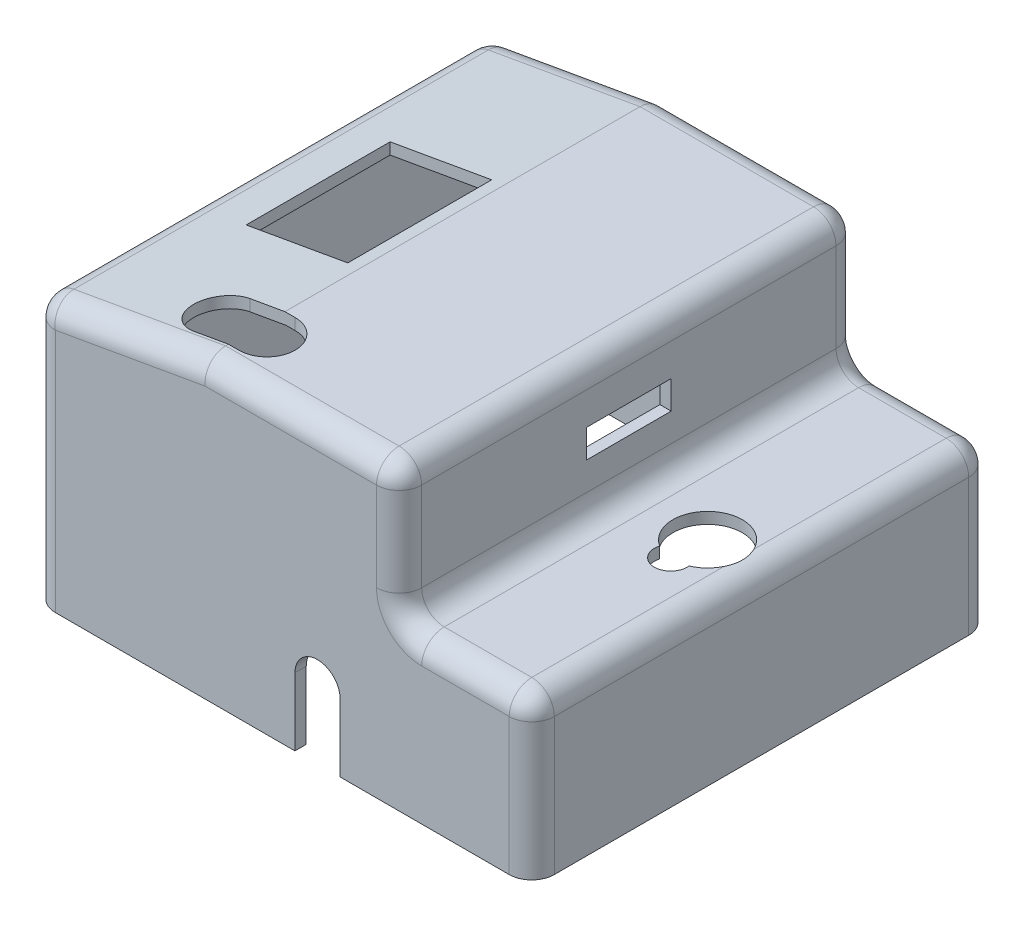
from build123d import *

# Parameters (mm, degrees)
BOSS_EXTRUDE1_DEPTH      = 38.7
BOSS_EXTRUDE1_DEPTH_BACK = 38.7
CHAMFER1_SIZE            = 5
CHAMFER1_SIZE2           = 28.356409098
SHELL1_T                 = 2
FILLET2_R                = 4
BOSS_EXTRUDE2_START      = -1.5
SKETCH2_W                = 6
SKETCH2_H                = 2.5
SKETCH2_H_2              = 6
SKETCH2_R                = 1.45
BOSS_EXTRUDE2_DEPTH      = 4
FILLET3_R                = 2
CUT_EXTRUDE1_REACH       = 68.394
SKETCH3_R                = 6.15
SKETCH3_R_2              = 2.9
BOSS_EXTRUDE3_START      = -1.5
SKETCH4_W                = 5
SKETCH4_H                = 20
BOSS_EXTRUDE3_DEPTH      = 2
FILLET4_R                = 2
CUT_EXTRUDE2_REACH       = 94.588
SKETCH5_W                = 15
SKETCH5_H                = 5
CUT_EXTRUDE3_DEPTH       = 107.224291049
CUT_EXTRUDE4_REACH       = 92.819
SKETCH7_W                = 18
SKETCH7_H                = 25.5
CUT_EXTRUDE5_REACH       = 81.462
CUT_EXTRUDE6_REACH       = 108.224
SKETCH10_W               = 13
SKETCH10_H               = 8
FILLET5_R                = 2


with BuildPart() as part:
    # Sketch1 → Boss-Extrude1 (new, two sides: drawn at the far end of the back side and taken through both)
    with BuildSketch(Plane.XY.offset(-BOSS_EXTRUDE1_DEPTH_BACK)):
        Polygon((-42.2, 0), (42.2, 0), (42.2, 26.25), (18.7, 26.25), (18.7, 50), (-42.2, 50), align=None)
    extrude(amount=BOSS_EXTRUDE1_DEPTH + BOSS_EXTRUDE1_DEPTH_BACK)

    # Chamfer1
    chamfer1_edges = [part.edges().sort_by_distance(p)[0] for p in [
        (-42.2, 50, 0),
    ]]
    chamfer1_side = [part.faces().sort_by_distance(p)[0] for p in [
        (-42.2, 25, 0),
    ]]
    chamfer(chamfer1_edges, length=CHAMFER1_SIZE, length2=CHAMFER1_SIZE2, reference=chamfer1_side[0])

    # Shell1
    shell1_openings = [part.faces().sort_by_distance(p)[0] for p in [
        (0, 0, 0),
    ]]
    offset(amount=SHELL1_T, openings=shell1_openings, kind=Kind.INTERSECTION)

    # Fillet2
    # the kernel refuses this fillet: 4 mm, written as the material it adds along each edge
    with BuildSketch(Plane(origin=(20.7, 28.25, -40.7), x_dir=(0, 1, 0), z_dir=(0, 0, 1))) as fillet2_piece_1:
        with BuildLine():
            CenterArc((FILLET2_R, -FILLET2_R), FILLET2_R, 90, 90)
            Line((0, -FILLET2_R), (0, 0))
            Line((0, 0), (FILLET2_R, 0))
        make_face()
    extrude(amount=81.4)
    # the kernel refuses this fillet: 4 mm, written as the material it takes off along each edge
    with BuildSketch(Plane(origin=(-40.2, 43.321800738, 36.7), x_dir=(-0.1736481776669273, 0.9848077530122087, 0), z_dir=(0, 0, 1))) as fillet2_2_piece_1_section:
        Polygon((0, 0), (FILLET2_R, 0), (FILLET2_R, FILLET2_R * 0.839099631177), (FILLET2_R * 0.173648177667, FILLET2_R * 0.984807753012), align=None)
    fillet2_2_piece_1 = extrude(amount=FILLET2_R, mode=Mode.PRIVATE)
    fillet2_2_piece_1 = fillet2_2_piece_1 - Plane(origin=(-40.2, 43.321800738, 36.7), x_dir=(0.766044443118977, -0.6427876096865405, 0), z_dir=(0, 0, 1)) * Sphere(FILLET2_R, mode=Mode.PRIVATE)
    add(fillet2_2_piece_1, mode=Mode.SUBTRACT)
    with BuildSketch(Plane(origin=(-40.2, 43.321800738, -36.7), x_dir=(-0.1736481776669273, 0.9848077530122087, 0), z_dir=(0, 0, -1))) as fillet2_2_piece_2_section:
        Polygon((0, 0), (FILLET2_R, 0), (FILLET2_R, -FILLET2_R * 0.839099631177), (FILLET2_R * 0.173648177667, -FILLET2_R * 0.984807753012), align=None)
    fillet2_2_piece_2 = extrude(amount=FILLET2_R, mode=Mode.PRIVATE)
    fillet2_2_piece_2 = fillet2_2_piece_2 - Plane(origin=(-40.2, 43.321800738, -36.7), x_dir=(0.766044443118977, -0.6427876096865405, 0), z_dir=(0, 0, -1)) * Sphere(FILLET2_R, mode=Mode.PRIVATE)
    add(fillet2_2_piece_2, mode=Mode.SUBTRACT)
    with BuildSketch(Plane(origin=(20.7, 52, 50.7), x_dir=(0, -1, 0), z_dir=(0, 0, -1)), Plane(origin=(44.2, 28.25, 50.7), x_dir=(0, -1, 0), z_dir=(0, 0, -1))) as fillet2_2_piece_3:
        with BuildLine():
            CenterArc((FILLET2_R, FILLET2_R), FILLET2_R, 180, 90)
            Line((0, FILLET2_R), (0, 0))
            Line((0, 0), (FILLET2_R, 0))
        make_face()
    extrude(amount=101.4, mode=Mode.SUBTRACT)
    with BuildSketch(Plane(origin=(44.2, 38.25, -40.7), x_dir=(0, 0, 1), z_dir=(0, -1, 0))) as fillet2_2_piece_4:
        with BuildLine():
            CenterArc((FILLET2_R, FILLET2_R), FILLET2_R, 180, 90)
            Line((0, FILLET2_R), (0, 0))
            Line((0, 0), (FILLET2_R, 0))
        make_face()
    extrude(amount=48.25, mode=Mode.SUBTRACT)
    with BuildSketch(Plane(origin=(44.2, -10, 40.7), x_dir=(-1, 0, 0), z_dir=(0, 1, 0))) as fillet2_2_piece_5:
        with BuildLine():
            CenterArc((FILLET2_R, -FILLET2_R), FILLET2_R, 90, 90)
            Line((0, -FILLET2_R), (0, 0))
            Line((0, 0), (FILLET2_R, 0))
        make_face()
    extrude(amount=48.25, mode=Mode.SUBTRACT)
    with BuildSketch(Plane(origin=(30.7, 52, 40.7), x_dir=(0, -1, 0), z_dir=(-1, 0, 0)), Plane(origin=(-24.018568229, 52, -40.7), x_dir=(0, -1, 0), z_dir=(1, 0, 0))) as fillet2_2_piece_6:
        with BuildLine():
            CenterArc((FILLET2_R, -FILLET2_R), FILLET2_R, 90, 90)
            Line((0, -FILLET2_R), (0, 0))
            Line((0, 0), (FILLET2_R, 0))
        make_face()
    extrude(amount=54.718568229, mode=Mode.SUBTRACT)
    with BuildSketch(Plane(origin=(-44.2, 43.321800738, 40.7), x_dir=(0, 0, -1), z_dir=(0, -1, 0)), Plane(origin=(-44.2, -10, -40.7), x_dir=(0, 0, 1), z_dir=(0, 1, 0))) as fillet2_2_piece_7:
        with BuildLine():
            CenterArc((FILLET2_R, FILLET2_R), FILLET2_R, 180, 90)
            Line((0, FILLET2_R), (0, 0))
            Line((0, 0), (FILLET2_R, 0))
        make_face()
    extrude(amount=53.321800738, mode=Mode.SUBTRACT)
    with BuildSketch(Plane(origin=(-4.170490699, 53.736481777, 40.7), x_dir=(0.17364817766692728, -0.9848077530122086, 0), z_dir=(-0.9848077530122087, -0.1736481776669273, 0)), Plane(origin=(-40.894592711, 47.26103175, -40.7), x_dir=(0.1736481776669273, -0.9848077530122087, 1.77635683940025e-15), z_dir=(0.9848077530122087, 0.1736481776669273, 0))) as fillet2_2_piece_8:
        with BuildLine():
            CenterArc((FILLET2_R, -FILLET2_R), FILLET2_R, 90, 90)
            Line((0, -FILLET2_R), (0, 0))
            Line((0, 0), (FILLET2_R, 0))
        make_face()
    extrude(amount=37.29063048, mode=Mode.SUBTRACT)
    with BuildSketch(Plane(origin=(-44.2, 46.678199262, -36.7), x_dir=(0, -1, 0), z_dir=(0, 0, 1))) as fillet2_2_piece_9:
        with BuildLine():
            CenterArc((FILLET2_R * 0.839099631177, FILLET2_R), FILLET2_R, 190, 80)
            Line((-FILLET2_R * 0.145708121835, FILLET2_R * 0.826351822333), (0, 0))
            Line((0, 0), (FILLET2_R * 0.839099631177, 0))
        make_face()
    extrude(amount=73.4, mode=Mode.SUBTRACT)
    # the kernel refuses this fillet: 4 mm, written as the material it takes off along each edge
    with BuildSketch(Plane(origin=(16.7, 48, -36.7), x_dir=(1, 0, 0), z_dir=(0, 0, -1))) as fillet2_3_piece_1_section:
        Polygon((0, 0), (FILLET2_R, 0), (FILLET2_R, -FILLET2_R), (0, -FILLET2_R), align=None)
    fillet2_3_piece_1 = extrude(amount=FILLET2_R, mode=Mode.PRIVATE)
    fillet2_3_piece_1 = fillet2_3_piece_1 - Plane(origin=(16.7, 48, -36.7), x_dir=(-0.7071067811865475, -0.7071067811865476, 0), z_dir=(0, 0, -1)) * Sphere(FILLET2_R, mode=Mode.PRIVATE)
    add(fillet2_3_piece_1, mode=Mode.SUBTRACT)
    with BuildSketch(Plane(origin=(16.7, 48, 36.7), x_dir=(1, 0, 0), z_dir=(0, 0, 1))) as fillet2_3_piece_2_section:
        Polygon((0, 0), (FILLET2_R, 0), (FILLET2_R, FILLET2_R), (0, FILLET2_R), align=None)
    fillet2_3_piece_2 = extrude(amount=FILLET2_R, mode=Mode.PRIVATE)
    fillet2_3_piece_2 = fillet2_3_piece_2 - Plane(origin=(16.7, 48, 36.7), x_dir=(-0.7071067811865475, -0.7071067811865476, 0), z_dir=(0, 0, 1)) * Sphere(FILLET2_R, mode=Mode.PRIVATE)
    add(fillet2_3_piece_2, mode=Mode.SUBTRACT)
    with BuildSketch(Plane(origin=(40.2, 24.25, 36.7), x_dir=(0, 1, 0), z_dir=(0, 0, 1))) as fillet2_3_piece_3_section:
        Polygon((0, 0), (FILLET2_R, 0), (FILLET2_R, -FILLET2_R), (0, -FILLET2_R), align=None)
    fillet2_3_piece_3 = extrude(amount=FILLET2_R, mode=Mode.PRIVATE)
    fillet2_3_piece_3 = fillet2_3_piece_3 - Plane(origin=(40.2, 24.25, 36.7), x_dir=(-0.7071067811865475, -0.7071067811865476, 0), z_dir=(0, 0, 1)) * Sphere(FILLET2_R, mode=Mode.PRIVATE)
    add(fillet2_3_piece_3, mode=Mode.SUBTRACT)
    with BuildSketch(Plane(origin=(40.2, 24.25, -36.7), x_dir=(0, 1, 0), z_dir=(0, 0, -1))) as fillet2_3_piece_4_section:
        Polygon((0, 0), (FILLET2_R, 0), (FILLET2_R, FILLET2_R), (0, FILLET2_R), align=None)
    fillet2_3_piece_4 = extrude(amount=FILLET2_R, mode=Mode.PRIVATE)
    fillet2_3_piece_4 = fillet2_3_piece_4 - Plane(origin=(40.2, 24.25, -36.7), x_dir=(-0.7071067811865475, -0.7071067811865476, 0), z_dir=(0, 0, -1)) * Sphere(FILLET2_R, mode=Mode.PRIVATE)
    add(fillet2_3_piece_4, mode=Mode.SUBTRACT)
    with BuildSketch(Plane(origin=(24.7, 28.25, -40.7), x_dir=(0, -1, 0), z_dir=(1, 0, 0)), Plane(origin=(40.2, 28.25, 40.7), x_dir=(0, -1, 0), z_dir=(-1, 0, 0))) as fillet2_3_piece_5:
        with BuildLine():
            CenterArc((FILLET2_R, -FILLET2_R), FILLET2_R, 90, 90)
            Line((0, -FILLET2_R), (0, 0))
            Line((0, 0), (FILLET2_R, 0))
        make_face()
    extrude(amount=15.5, mode=Mode.SUBTRACT)
    with BuildSketch(Plane(origin=(20.7, 32.25, 40.7), x_dir=(-1, 0, 0), z_dir=(0, 1, 0)), Plane(origin=(20.7, 48, -40.7), x_dir=(-1, 0, 0), z_dir=(0, -1, 0))) as fillet2_3_piece_6:
        with BuildLine():
            CenterArc((FILLET2_R, -FILLET2_R), FILLET2_R, 90, 90)
            Line((0, -FILLET2_R), (0, 0))
            Line((0, 0), (FILLET2_R, 0))
        make_face()
    extrude(amount=15.75, mode=Mode.SUBTRACT)
    with BuildSketch(Plane(origin=(24.7, 32.25, -40.7), x_dir=(-1, 0, 0), z_dir=(0, 1, 0))) as fillet2_3_piece_7:
        with BuildLine():
            CenterArc((4 + FILLET2_R, FILLET2_R), FILLET2_R, 180, 90)
            Line((4, FILLET2_R), (4, 0))
            Line((4, 0), (4 + FILLET2_R, 0))
        make_face()
    revolve(axis=Axis((24.7, 32.25, -40.7), (0, 0, 1)), revolution_arc=90, mode=Mode.SUBTRACT)
    with BuildSketch(Plane(origin=(24.7, 32.25, 40.7), x_dir=(-1, 0, 0), z_dir=(0, 1, 0))) as fillet2_3_piece_8:
        with BuildLine():
            CenterArc((4 + FILLET2_R, -FILLET2_R), FILLET2_R, 90, 90)
            Line((4, -FILLET2_R), (4, 0))
            Line((4, 0), (4 + FILLET2_R, 0))
        make_face()
    revolve(axis=Axis((24.7, 32.25, 40.7), (0, 0, 1)), revolution_arc=90, mode=Mode.SUBTRACT)

    # Sketch2 → Boss-Extrude2 (add)
    # profile 1 of 2: a face of its own
    with BuildSketch(Plane.XZ.offset(BOSS_EXTRUDE2_START)):
        with Locations((39.2, -37.45)):
            Rectangle(SKETCH2_W, SKETCH2_H)
    # profile 2 of 2: a face of its own
    with BuildSketch(Plane.XZ.offset(BOSS_EXTRUDE2_START)):
        with Locations((39.2, -33.2)):
            Rectangle(SKETCH2_W, SKETCH2_H_2)
        with Locations(Location((39.2, -33.2, 0), (0, 0, 270))):
            Circle(SKETCH2_R, mode=Mode.SUBTRACT)
    boss_extrude2 = extrude(amount=-BOSS_EXTRUDE2_DEPTH)

    # Mirror1: Boss-Extrude2 across plane
    add(boss_extrude2.mirror(Plane.XY))

    # Fillet3
    fillet3_edges = [part.edges().sort_by_distance(p)[0] for p in [
        (42.2, 3.5, -30.2),
        (36.2, 3.5, -38.7),
        (36.2, 3.5, -30.2),
        (42.2, 3.5, 30.2),
        (36.2, 3.5, 30.2),
        (36.2, 3.5, 38.7),
    ]]
    fillet(fillet3_edges, radius=FILLET3_R)

    # Sketch3 → Cut-Extrude1 (cut, up to next)
    with BuildSketch(Plane(origin=(0, 28.25, 0), x_dir=(1, 0, 0), z_dir=(0, 1, 0)), mode=Mode.PRIVATE) as cut_extrude1_sk1:
        with Locations((34.65, 0)):
            Circle(SKETCH3_R)
    cut_extrude1_tool1 = extrude(cut_extrude1_sk1.sketch, amount=-CUT_EXTRUDE1_REACH, mode=Mode.PRIVATE) & part.part
    # Sketch3 → Cut-Extrude1 (cut, up to next)
    with BuildSketch(Plane(origin=(0, 28.25, 0), x_dir=(1, 0, 0), z_dir=(0, 1, 0)), mode=Mode.PRIVATE) as cut_extrude1_sk2:
        with Locations((34.151698836, -6.029444083)):
            Circle(SKETCH3_R_2)
    cut_extrude1_tool2 = extrude(cut_extrude1_sk2.sketch, amount=-CUT_EXTRUDE1_REACH, mode=Mode.PRIVATE) & part.part
    add(cut_extrude1_tool1.solids().sort_by_distance((34.65, 28.25, 0))[0], mode=Mode.SUBTRACT)
    add(cut_extrude1_tool2.solids().sort_by_distance((34.151699, 28.25, 6.029444))[0], mode=Mode.SUBTRACT)

    # Sketch4 → Boss-Extrude3 (add)
    with BuildSketch(Plane.XZ.offset(BOSS_EXTRUDE3_START)):
        with Locations((-39.7, 0)):
            Rectangle(SKETCH4_W, SKETCH4_H)
    extrude(amount=-BOSS_EXTRUDE3_DEPTH)

    # Fillet4
    fillet4_edges = [part.edges().sort_by_distance(p)[0] for p in [
        (-42.2, 3.5, 0),
        (-42.2, 2.5, -10),
        (-42.2, 2.5, 10),
    ]]
    fillet(fillet4_edges, radius=FILLET4_R)

    # Sketch5 → Cut-Extrude2 (cut, up to next)
    with BuildSketch(Plane(origin=(20.7, 0, 0), x_dir=(0, 0, -1), z_dir=(1, 0, 0)), mode=Mode.PRIVATE) as cut_extrude2_sk1:
        with Locations((0, 39.75)):
            Rectangle(SKETCH5_W, SKETCH5_H)
    cut_extrude2_tool1 = extrude(cut_extrude2_sk1.sketch, amount=-CUT_EXTRUDE2_REACH, mode=Mode.PRIVATE) & part.part
    add(cut_extrude2_tool1.solids().sort_by_distance((20.7, 39.75, 0))[0], mode=Mode.SUBTRACT)

    # Sketch6 → Cut-Extrude3 (cut, through all)
    with BuildSketch(Plane.XY.offset(40.7)):
        with BuildLine():
            Line((2.25, 0), (2.25, 12))
            ThreePointArc((2.25, 12), (6.25, 16), (10.25, 12))
            Line((10.25, 12), (10.25, 0))
            ThreePointArc((10.25, 0), (6.25, -4), (2.25, 0))
        make_face()
    extrude(amount=-CUT_EXTRUDE3_DEPTH, mode=Mode.SUBTRACT)

    # Cut-Extrude4: up to this plane
    cut_extrude4_end = Plane(origin=(-13.843590902, 50, -38.7), z_dir=(0.17364817766693147, -0.9848077530122079, 0))
    # Sketch7 → Cut-Extrude4 (cut, up to the surface)
    with BuildSketch(Plane(origin=(-18.150298314, 52, 0), x_dir=(1, 0, 0), z_dir=(0, 1, 0)), mode=Mode.PRIVATE) as cut_extrude4_sk1:
        with Locations((-7.191454162, 0)):
            Rectangle(SKETCH7_W, SKETCH7_H)
    cut_extrude4_tool1 = split(extrude(cut_extrude4_sk1.sketch, amount=-CUT_EXTRUDE4_REACH, mode=Mode.PRIVATE), bisect_by=cut_extrude4_end, keep=Keep.BOTH, mode=Mode.PRIVATE)
    add(cut_extrude4_tool1.solids().sort_by_distance((-25.341752, 52, 0))[0], mode=Mode.SUBTRACT)

    # Sketch8 → Cut-Extrude5 (cut, up to next)
    with BuildSketch(Plane(origin=(0, 52, 0), x_dir=(1, 0, 0), z_dir=(0, 1, 0)), mode=Mode.PRIVATE) as cut_extrude5_sk1:
        with BuildLine():
            Line((-12.2, -36.2), (-20.2, -36.2))
            ThreePointArc((-20.2, -36.2), (-25.2, -31.2), (-20.2, -26.2))
            Line((-20.2, -26.2), (-12.2, -26.2))
            ThreePointArc((-12.2, -26.2), (-7.2, -31.2), (-12.2, -36.2))
        make_face()
    cut_extrude5_tool1 = extrude(cut_extrude5_sk1.sketch, amount=-CUT_EXTRUDE5_REACH, mode=Mode.PRIVATE) & part.part
    add(cut_extrude5_tool1.solids().sort_by_distance((-16.2, 52, 31.2))[0], mode=Mode.SUBTRACT)

    # Sketch10 → Cut-Extrude6 (cut, up to next)
    with BuildSketch(Plane(origin=(0, 0, -40.7), x_dir=(-1, 0, 0), z_dir=(0, 0, -1)), mode=Mode.PRIVATE) as cut_extrude6_sk1:
        with Locations((18.2, 34.5)):
            Rectangle(SKETCH10_W, SKETCH10_H)
    cut_extrude6_tool1 = extrude(cut_extrude6_sk1.sketch, amount=-CUT_EXTRUDE6_REACH, mode=Mode.PRIVATE) & part.part
    add(cut_extrude6_tool1.solids().sort_by_distance((-18.2, 34.5, -40.7))[0], mode=Mode.SUBTRACT)

    # Fillet5
    fillet5_edges = [part.edges().sort_by_distance(p)[0] for p in [
        (-24.7, 38.5, -39.7),
        (-24.7, 30.5, -39.7),
        (-11.7, 30.5, -39.7),
        (-11.7, 38.5, -39.7),
    ]]
    fillet(fillet5_edges, radius=FILLET5_R)


solid = part.part
